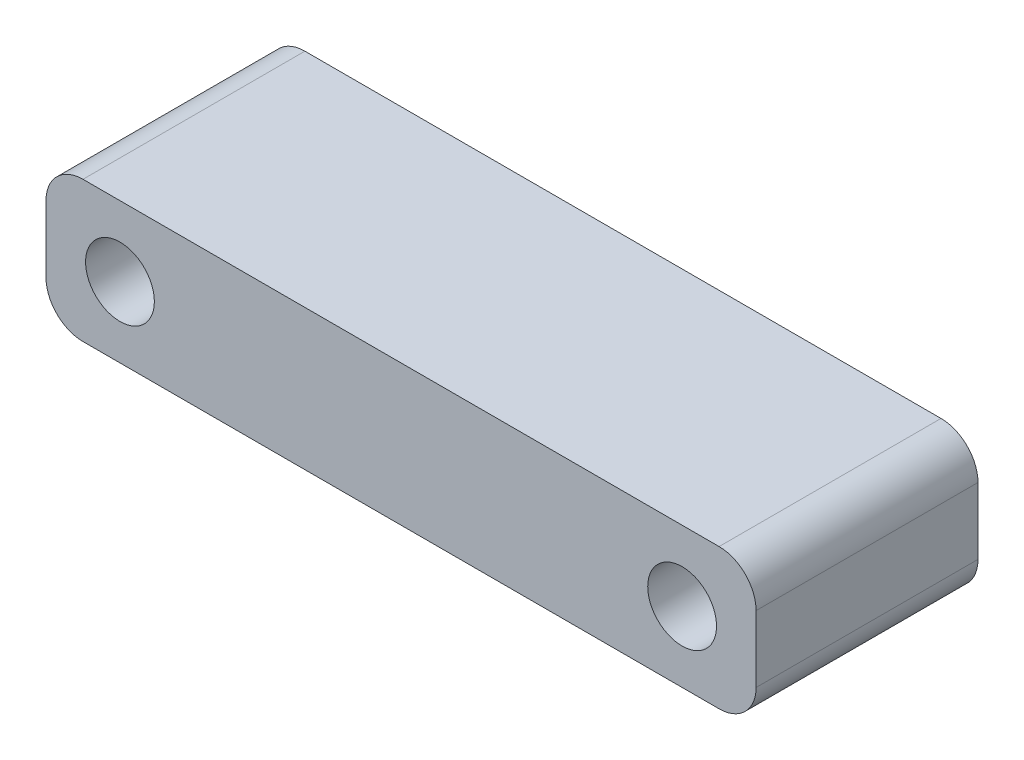
from build123d import *

# Parameters (mm, degrees)
SKETCH_1_W      = 96
SKETCH_1_H      = 19
SKETCH_1_R      = 4.65
EXTRUDE_1_DEPTH = 30
FILLET_1_R      = 5


with BuildPart() as part:
    # 草图1 → 凸台-拉伸1 (new body)
    with BuildSketch(Plane.XY):
        Rectangle(SKETCH_1_W, SKETCH_1_H)
        with Locations((-38, 0)):
            Circle(SKETCH_1_R, mode=Mode.SUBTRACT)
        with Locations((38, 0)):
            Circle(SKETCH_1_R, mode=Mode.SUBTRACT)
    extrude(amount=EXTRUDE_1_DEPTH)

    # 圆角1
    fillet_1_edges = [part.edges().sort_by_distance(p)[0] for p in [
        (-48, -9.5, 15),
        (-48, 9.5, 15),
        (48, -9.5, 15),
        (48, 9.5, 15),
    ]]
    fillet(fillet_1_edges, radius=FILLET_1_R)


solid = part.part
